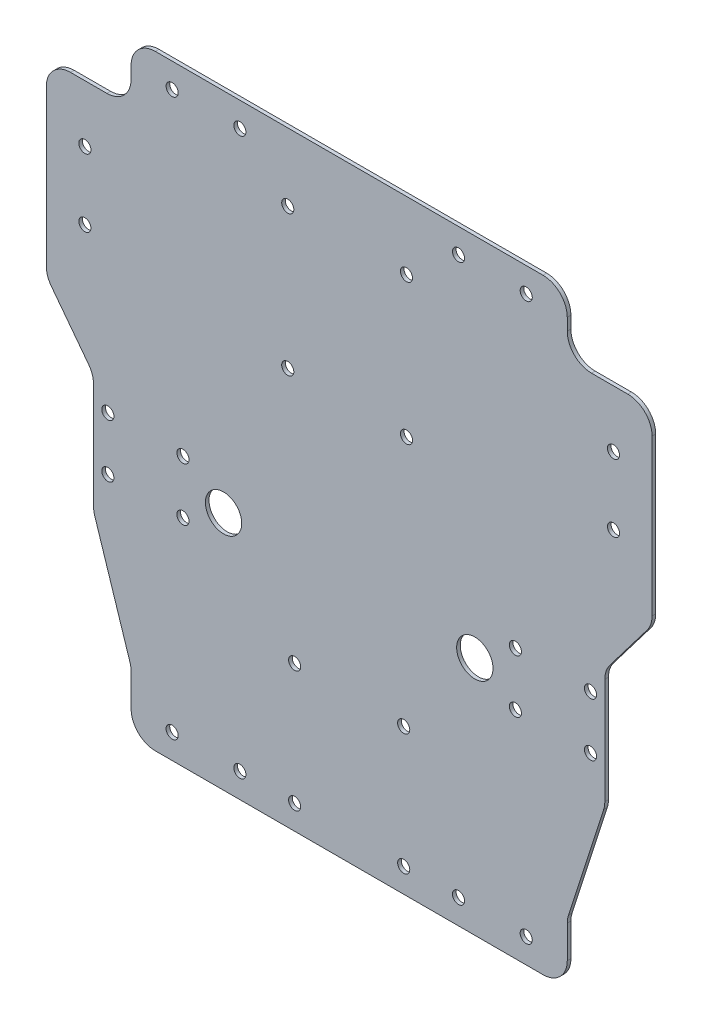
from build123d import *

# Parameters (mm, degrees)
SKETCH1_W               = 300
SKETCH1_H               = 250
BOSS_EXTRUDE1_DEPTH     = 1.5
CUT_EXTRUDE1_DEPTH      = 391.515364615
CUT_EXTRUDE1_DEPTH_BACK = 391.515364615
SKETCH3_R               = 7.5
SKETCH6_W               = 35
SKETCH6_H               = 25
SKETCH6_W_2             = 12.5
SKETCH6_H_2             = 77.656290199
CUT_EXTRUDE3_DEPTH      = 381.996719146
SKETCH5_R               = 2.5
CUT_EXTRUDE2_DEPTH      = 372.654745698
FILLET1_R               = 10


with BuildPart() as part:
    # Sketch1 → Boss-Extrude1 (new body)
    with BuildSketch(Plane.XY):
        with Locations((150, 125)):
            Rectangle(SKETCH1_W, SKETCH1_H)
    extrude(amount=-BOSS_EXTRUDE1_DEPTH)

    # Sketch3 → Cut-Extrude1 (cut, two sides: drawn at the far end of the back side and taken through both)
    with BuildSketch(Plane.XY.offset(-CUT_EXTRUDE1_DEPTH_BACK)):
        Polygon((0, 0), (25, 0), (25, 47.343709801), (44.5, 73.000027506), (44.5, 121.687392097), (25, 147.343709801), (12.5, 147.343709801), (12.5, 225), (25, 225), (25, 250), (0, 250), align=None)
        Polygon((275, 0), (300, 0), (300, 250), (275, 250), (275, 225), (287.5, 225), (287.5, 147.343709801), (275, 147.343709801), (255.5, 121.687392097), (255.5, 73.000027506), (275, 47.343709801), align=None)
        with Locations((201.85, 99.125843129)):
            Circle(SKETCH3_R)
        with Locations((98.15, 99.125843129)):
            Circle(SKETCH3_R)
    extrude(amount=CUT_EXTRUDE1_DEPTH + CUT_EXTRUDE1_DEPTH_BACK, mode=Mode.SUBTRACT)

    # Sketch6 → Cut-Extrude3 (cut, through all)
    with BuildSketch(Plane.XY):
        Polygon((25, 0), (60, 0), (60, 25), (44.5, 73.000027506), (25, 47.343709801), align=None)
        Polygon((240, 0), (275, 0), (275, 47.343709801), (255.5, 73.000027506), (240, 25), align=None)
        with Locations((257.5, 237.5)):
            Rectangle(SKETCH6_W, SKETCH6_H)
        with Locations((281.25, 186.171854901)):
            Rectangle(SKETCH6_W_2, SKETCH6_H_2)
        with Locations((18.75, 186.171854901)):
            Rectangle(SKETCH6_W_2, SKETCH6_H_2)
        with Locations((42.5, 237.5)):
            Rectangle(SKETCH6_W, SKETCH6_H)
    extrude(amount=-CUT_EXTRUDE3_DEPTH, mode=Mode.SUBTRACT)

    # Sketch5 → Cut-Extrude2 (cut, symmetric)
    with BuildSketch(Plane.XY):
        with Locations((76.94, 10.16)):
            Circle(SKETCH5_R)
    cut_extrude2 = extrude(amount=CUT_EXTRUDE2_DEPTH, both=True, mode=Mode.SUBTRACT)

    # Sketch-Pattern1: Cut-Extrude2 at 27 more places
    with Locations((-36.023145, 191.31, 0), (-36.023145, 163.37, 0), (0, 229.68, 0), (27.94, 229.68, 0), (118.18, 229.68, 0), (146.12, 229.68, 0), (182.143145, 191.31, 0), (182.143145, 163.37, 0), (118.18, 0, 0), (146.12, 0, 0), (27.94, 0, 0), (50.56, -0.16, 0), (95.56, -0.16, 0), (50.56, 49.84, 0), (95.56, 49.84, 0), (47.705277, 153.86209, 0), (96.705277, 153.86209, 0), (47.705277, 211.86209, 0), (96.705277, 211.86209, 0), (141.66, 100.84, 0), (172.66, 100.84, 0), (172.66, 78.84, 0), (141.66, 78.84, 0), (4.46, 78.846294, 0), (-26.54, 78.846294, 0), (4.46, 100.846294, 0), (-26.54, 100.846294, 0)):
        add(cut_extrude2, mode=Mode.SUBTRACT)

    # Fillet1
    fillet1_edges = [part.edges().sort_by_distance(p)[0] for p in [
        (255.5, 121.687392097, -0.75),
        (44.5, 121.687392097, -0.75),
        (240, 250, -0.75),
        (240, 225, -0.75),
        (60, 250, -0.75),
        (60, 225, -0.75),
        (44.5, 73.000027506, -0.75),
        (60, 25, -0.75),
        (60, 0, -0.75),
        (255.5, 73.000027506, -0.75),
        (240, 25, -0.75),
        (240, 0, -0.75),
        (275, 225, -0.75),
        (275, 147.343709801, -0.75),
        (25, 225, -0.75),
        (25, 147.343709801, -0.75),
    ]]
    fillet(fillet1_edges, radius=FILLET1_R)


solid = part.part
